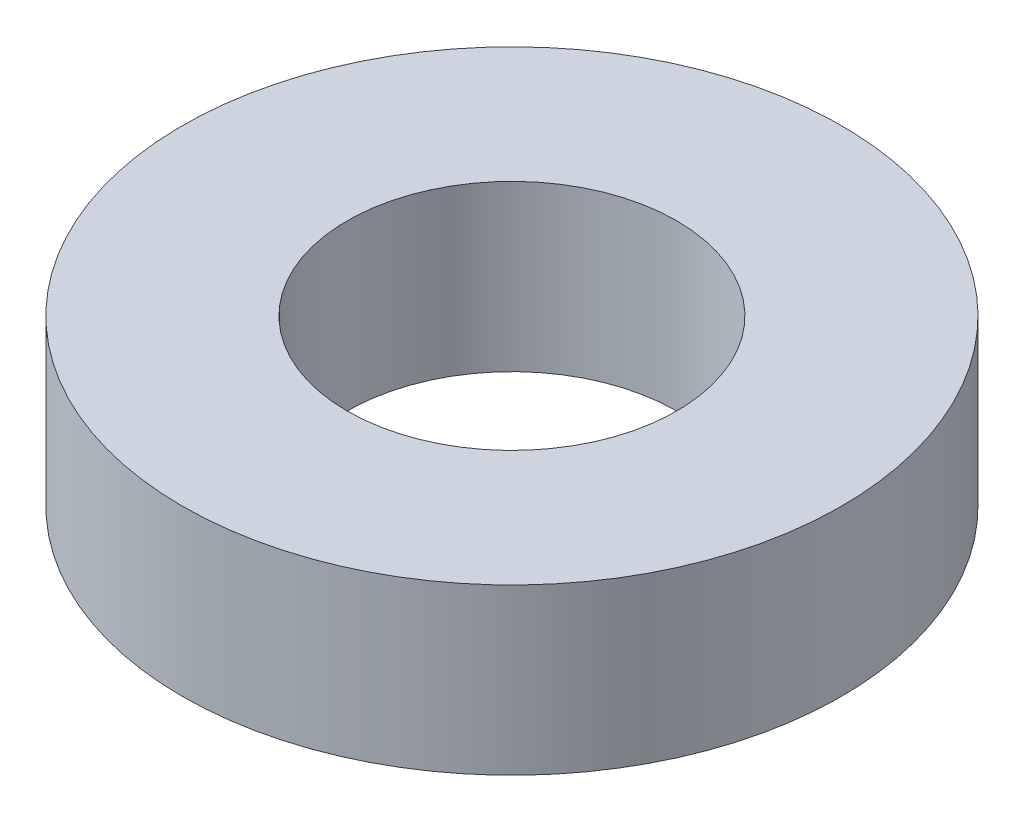
from build123d import *

# Parameters (mm, degrees)
ESQUISSE1_R        = 8
ESQUISSE1_R_2      = 4
BOSS_EXTRU_1_DEPTH = 4


with BuildPart() as part:
    # Esquisse1 → Boss.-Extru.1 (new body)
    with BuildSketch(Plane(origin=(0, 0, 0), x_dir=(1, 0, 0), z_dir=(0, 1, 0))):
        Circle(ESQUISSE1_R)
        Circle(ESQUISSE1_R_2, mode=Mode.SUBTRACT)
    extrude(amount=BOSS_EXTRU_1_DEPTH)


solid = part.part
